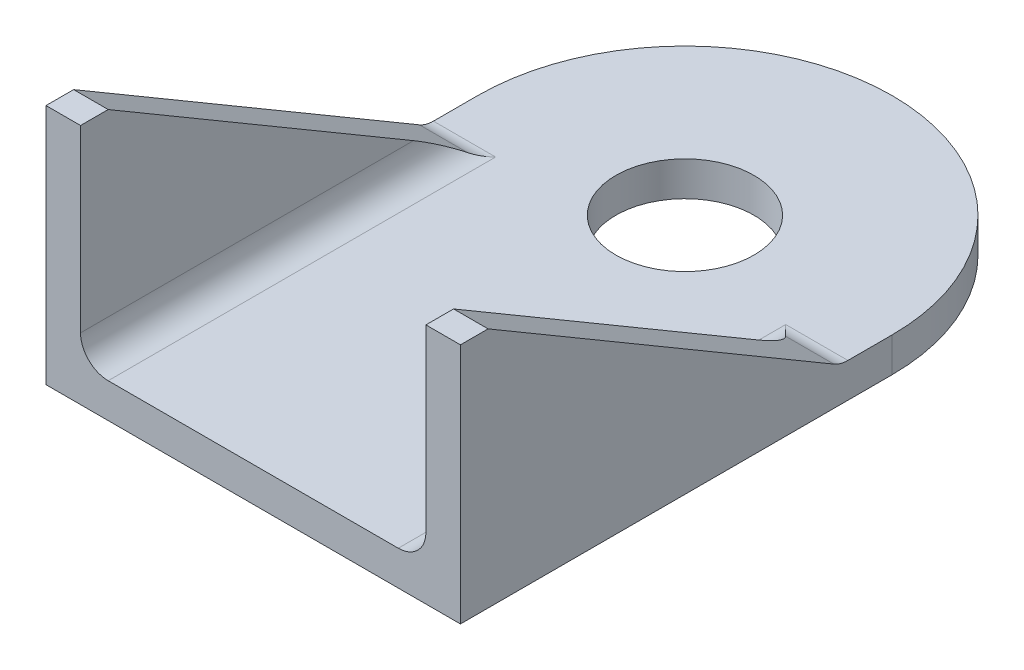
from build123d import *

# Parameters (mm, degrees)
SKETCH_1_R             = 4
EXTRUDE_1_DEPTH        = 2
EXTRUDE_2_DEPTH        = 2
FILLET_1_R             = 1.6
FILLET_1_OF_MIRROR_1_R = 1.6


with BuildPart() as part:
    # 草图1 → 凸台-拉伸1 (new body)
    with BuildSketch(Plane(origin=(0, 0, 0), x_dir=(1, 0, 0), z_dir=(0, 1, 0))):
        with BuildLine():
            Line((12, -25), (12, 0))
            ThreePointArc((12, 0), (0, 12), (-12, 0))
            Line((-12, 0), (-12, -25))
            Line((-12, -25), (12, -25))
        make_face()
        Circle(SKETCH_1_R, mode=Mode.SUBTRACT)
    extrude(amount=EXTRUDE_1_DEPTH)

    # 草图3 → 凸台-拉伸2 (add)
    with BuildSketch(Plane(origin=(12, 0, 0), x_dir=(0, 0, -1), z_dir=(1, 0, 0))):
        Polygon((-25, 2), (-25, 14), (-23.4, 14), (-3, 2), align=None)
    extrude_2 = extrude(amount=-EXTRUDE_2_DEPTH)

    # 圆角1
    fillet_1_edges = [part.edges().sort_by_distance(p)[0] for p in [
        (10, 2, 14),
        (11, 2, 3),
    ]]
    fillet(fillet_1_edges, radius=FILLET_1_R)

    # 镜向1: 凸台-拉伸2 across plane
    add(extrude_2.mirror(Plane(origin=(0, 0, 0), x_dir=(0, 0, 1), z_dir=(1, 0, 0))))

    # 圆角1 of 镜向1
    fillet_1_of_mirror_1_edges = [part.edges().sort_by_distance(p)[0] for p in [
        (-10, 2, 14),
        (-11, 2, 3),
    ]]
    fillet(fillet_1_of_mirror_1_edges, radius=FILLET_1_OF_MIRROR_1_R)


solid = part.part
